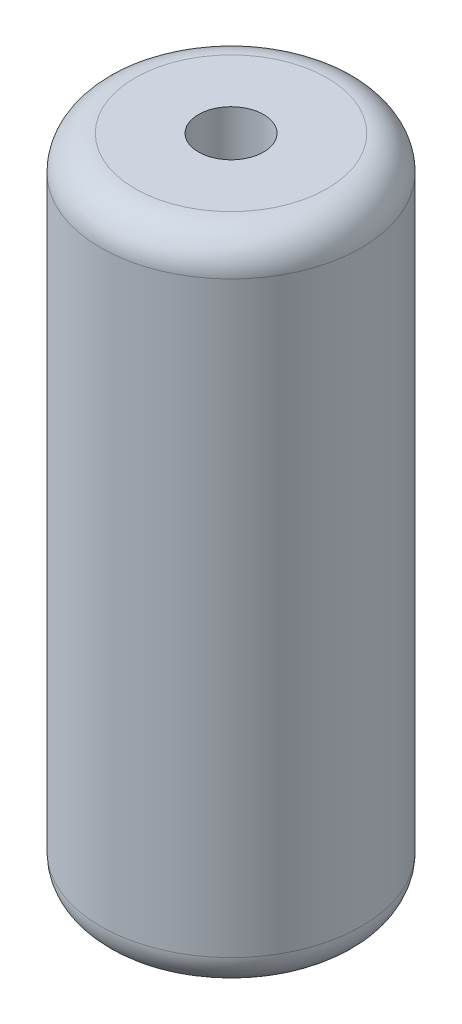
from build123d import *

# Parameters (mm, degrees)
CROQUIS1_R              = 19.05
CROQUIS1_R_2            = 4.7625
SALIENTE_EXTRUIR1_DEPTH = 96
REDONDEO1_R             = 5


with BuildPart() as part:
    # Croquis1 → Saliente-Extruir1 (new body)
    with BuildSketch(Plane(origin=(0, 0, 0), x_dir=(1, 0, 0), z_dir=(0, 1, 0))):
        Circle(CROQUIS1_R)
        Circle(CROQUIS1_R_2, mode=Mode.SUBTRACT)
    extrude(amount=SALIENTE_EXTRUIR1_DEPTH)

    # Redondeo1
    redondeo1_edges = [part.edges().sort_by_distance(p)[0] for p in [
        (-19.05, 0, 0),
        (-19.05, 96, 0),
    ]]
    fillet(redondeo1_edges, radius=REDONDEO1_R)


solid = part.part
